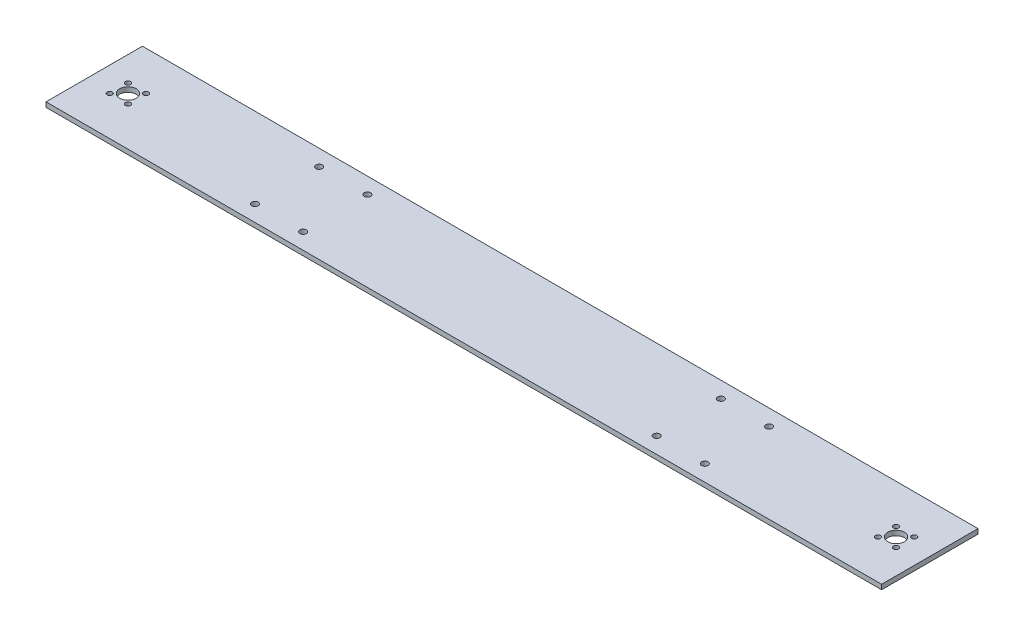
from build123d import *

# Parameters (mm, degrees)
SZKIC1_W                    = 520
SZKIC1_H                    = 60
DODANIE_WYCI_GNI_CIE1_DEPTH = 3
OTW_R_POD_RUB_M41_D         = 4
SZKIC8_R                    = 5.15
WYTNIJ_WYCI_GNI_CIE1_DEPTH  = 10
SZKIC9_R                    = 1.6
WYTNIJ_WYCI_GNI_CIE2_DEPTH  = 524.45868987
SZKIC10_R                   = 1.6
WYTNIJ_WYCI_GNI_CIE3_DEPTH  = 10


with BuildPart() as part:
    # Szkic1 → Dodanie-wyciągnięcie1 (new body)
    with BuildSketch(Plane(origin=(0, 0, 0), x_dir=(1, 0, 0), z_dir=(0, 1, 0))):
        with Locations((-260, 30)):
            Rectangle(SZKIC1_W, SZKIC1_H)
    extrude(amount=DODANIE_WYCI_GNI_CIE1_DEPTH)

    # Otwór pod śrubę M41 (through all)
    with Locations(Plane(origin=(0, 3, 0), x_dir=(1, 0, 0), z_dir=(0, 1, 0))):
        with Locations((-400, 50), (-370, 50), (-400, 10), (-370, 10), (-150, 50), (-120, 50), (-150, 10), (-120, 10)):
            Hole(OTW_R_POD_RUB_M41_D / 2)

    # Szkic8 → Wytnij-wyciągnięcie1 (cut)
    with BuildSketch(Plane(origin=(0, 3, 0), x_dir=(1, 0, 0), z_dir=(0, 1, 0))):
        with Locations((-21, 30)):
            Circle(SZKIC8_R)
        with Locations((-499, 30)):
            Circle(SZKIC8_R)
    extrude(amount=-WYTNIJ_WYCI_GNI_CIE1_DEPTH, mode=Mode.SUBTRACT)

    # Szkic9 → Wytnij-wyciągnięcie2 (cut, through all)
    with BuildSketch(Plane(origin=(0, 3, 0), x_dir=(1, 0, 0), z_dir=(0, 1, 0))):
        with Locations((-504.65, 35.663700204)):
            Circle(SZKIC9_R)
        with Locations((-493.336299796, 35.65)):
            Circle(SZKIC9_R)
        with Locations((-493.35, 24.336299796)):
            Circle(SZKIC9_R)
        with Locations((-504.663700204, 24.35)):
            Circle(SZKIC9_R)
    extrude(amount=-WYTNIJ_WYCI_GNI_CIE2_DEPTH, mode=Mode.SUBTRACT)

    # Szkic10 → Wytnij-wyciągnięcie3 (cut)
    with BuildSketch(Plane(origin=(0, 3, 0), x_dir=(1, 0, 0), z_dir=(0, 1, 0))):
        with Locations((-15.35, 35.663700204)):
            Circle(SZKIC10_R)
        with Locations((-15.336299796, 24.35)):
            Circle(SZKIC10_R)
        with Locations((-26.65, 24.336299796)):
            Circle(SZKIC10_R)
        with Locations((-26.663700204, 35.65)):
            Circle(SZKIC10_R)
    extrude(amount=-WYTNIJ_WYCI_GNI_CIE3_DEPTH, mode=Mode.SUBTRACT)


solid = part.part
